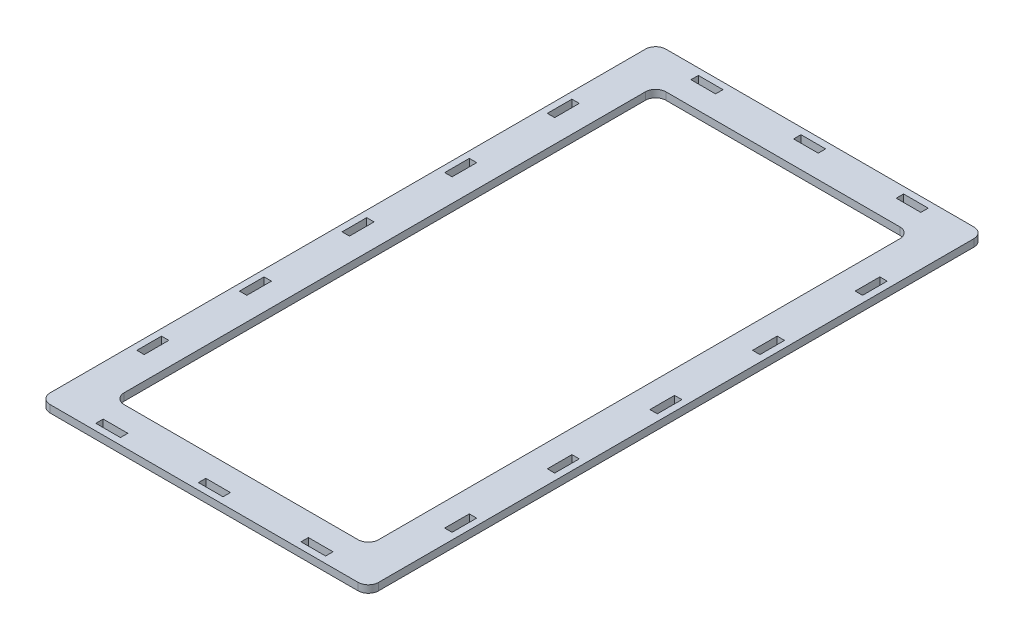
from build123d import *

# Parameters (mm, degrees)
SKETCH_1_W               = 800
SKETCH_1_H               = 1500
SKETCH_1_W_2             = 620
SKETCH_1_H_2             = 1320
EXTRUDE_1_DEPTH          = 18
SKETCH_1_5_W             = 18
SKETCH_1_5_H             = 60
CUT_EXTRUDE_1_DEPTH      = 851.190566873
PATTERN_LINEAR_1_COUNT   = 5
PATTERN_LINEAR_1_PITCH   = 250
MIRROR_1_COPY_1_SKETCH_W = 18
MIRROR_1_COPY_1_SKETCH_H = 60
MIRROR_1_COPY_1_DEPTH    = 851.190566873
MIRROR_1_COPY_2_SKETCH_W = 18
MIRROR_1_COPY_2_SKETCH_H = 60
MIRROR_1_COPY_2_DEPTH    = 851.190566873
MIRROR_1_COPY_3_SKETCH_W = 18
MIRROR_1_COPY_3_SKETCH_H = 60
MIRROR_1_COPY_3_DEPTH    = 851.190566873
MIRROR_1_COPY_4_SKETCH_W = 18
MIRROR_1_COPY_4_SKETCH_H = 60
MIRROR_1_COPY_4_DEPTH    = 851.190566873
SKETCH_1_4_W             = 60
SKETCH_1_4_H             = 18
CUT_EXTRUDE_2_DEPTH      = 851.190566873
PATTERN_LINEAR_2_COUNT   = 3
PATTERN_LINEAR_2_PITCH   = 250
MIRROR_2_COPY_1_SKETCH_W = 60
MIRROR_2_COPY_1_SKETCH_H = 18
MIRROR_2_COPY_1_DEPTH    = 851.190566873
MIRROR_2_COPY_2_SKETCH_W = 60
MIRROR_2_COPY_2_SKETCH_H = 18
MIRROR_2_COPY_2_DEPTH    = 851.190566873
FILLET_1_R               = 25
FILLET_2_R               = 25


with BuildPart() as part:
    # 草图1 → 凸台-拉伸1 (new body)
    with BuildSketch(Plane(origin=(0, 0, 0), x_dir=(1, 0, 0), z_dir=(0, 1, 0))):
        Rectangle(SKETCH_1_W, SKETCH_1_H)
        Rectangle(SKETCH_1_W_2, SKETCH_1_H_2, mode=Mode.SUBTRACT)
    extrude(amount=EXTRUDE_1_DEPTH)

    # 草图1<5> → 切除-拉伸1 (cut, through all)
    with BuildSketch(Plane(origin=(0, 0, 0), x_dir=(1, 0, 0), z_dir=(0, 1, 0))):
        with Locations((-375, -500)):
            Rectangle(SKETCH_1_5_W, SKETCH_1_5_H)
    cut_extrude_1 = extrude(amount=CUT_EXTRUDE_1_DEPTH, mode=Mode.SUBTRACT)

    # 阵列(线性)1: 切除-拉伸1 ×5
    with Locations(*[(0, 0, -i * PATTERN_LINEAR_1_PITCH) for i in range(1, PATTERN_LINEAR_1_COUNT)]):
        add(cut_extrude_1, mode=Mode.SUBTRACT)

    # 镜向1: 切除-拉伸1 across plane
    add(cut_extrude_1.mirror(Plane(origin=(0, 0, 0), x_dir=(0, 0, 1), z_dir=(1, 0, 0))), mode=Mode.SUBTRACT)

    # 镜向1 copy 1 sketch → 镜向1 copy 1 (cut, through all)
    with BuildSketch(Plane(origin=(0, 0, -250), x_dir=(-1, 0, 0), z_dir=(0, 1, 0))):
        with Locations((-375, 500)):
            Rectangle(MIRROR_1_COPY_1_SKETCH_W, MIRROR_1_COPY_1_SKETCH_H)
    extrude(amount=MIRROR_1_COPY_1_DEPTH, mode=Mode.SUBTRACT)

    # 镜向1 copy 2 sketch → 镜向1 copy 2 (cut, through all)
    with BuildSketch(Plane(origin=(0, 0, -500), x_dir=(-1, 0, 0), z_dir=(0, 1, 0))):
        with Locations((-375, 500)):
            Rectangle(MIRROR_1_COPY_2_SKETCH_W, MIRROR_1_COPY_2_SKETCH_H)
    extrude(amount=MIRROR_1_COPY_2_DEPTH, mode=Mode.SUBTRACT)

    # 镜向1 copy 3 sketch → 镜向1 copy 3 (cut, through all)
    with BuildSketch(Plane(origin=(0, 0, -750), x_dir=(-1, 0, 0), z_dir=(0, 1, 0))):
        with Locations((-375, 500)):
            Rectangle(MIRROR_1_COPY_3_SKETCH_W, MIRROR_1_COPY_3_SKETCH_H)
    extrude(amount=MIRROR_1_COPY_3_DEPTH, mode=Mode.SUBTRACT)

    # 镜向1 copy 4 sketch → 镜向1 copy 4 (cut, through all)
    with BuildSketch(Plane(origin=(0, 0, -1000), x_dir=(-1, 0, 0), z_dir=(0, 1, 0))):
        with Locations((-375, 500)):
            Rectangle(MIRROR_1_COPY_4_SKETCH_W, MIRROR_1_COPY_4_SKETCH_H)
    extrude(amount=MIRROR_1_COPY_4_DEPTH, mode=Mode.SUBTRACT)

    # 草图1<4> → 切除-拉伸2 (cut, through all)
    with BuildSketch(Plane(origin=(0, 0, 0), x_dir=(1, 0, 0), z_dir=(0, 1, 0))):
        with Locations((-250, -725)):
            Rectangle(SKETCH_1_4_W, SKETCH_1_4_H)
    cut_extrude_2 = extrude(amount=CUT_EXTRUDE_2_DEPTH, mode=Mode.SUBTRACT)

    # 阵列(线性)2: 切除-拉伸2 ×3
    with Locations(*[(i * PATTERN_LINEAR_2_PITCH, 0, 0) for i in range(1, PATTERN_LINEAR_2_COUNT)]):
        add(cut_extrude_2, mode=Mode.SUBTRACT)

    # 镜向2: 切除-拉伸2 across plane
    add(cut_extrude_2.mirror(Plane.XY), mode=Mode.SUBTRACT)

    # 镜向2 copy 1 sketch → 镜向2 copy 1 (cut, through all)
    with BuildSketch(Plane(origin=(250, 0, 0), x_dir=(1, 0, 0), z_dir=(0, 1, 0))):
        with Locations((-250, 725)):
            Rectangle(MIRROR_2_COPY_1_SKETCH_W, MIRROR_2_COPY_1_SKETCH_H)
    extrude(amount=MIRROR_2_COPY_1_DEPTH, mode=Mode.SUBTRACT)

    # 镜向2 copy 2 sketch → 镜向2 copy 2 (cut, through all)
    with BuildSketch(Plane(origin=(500, 0, 0), x_dir=(1, 0, 0), z_dir=(0, 1, 0))):
        with Locations((-250, 725)):
            Rectangle(MIRROR_2_COPY_2_SKETCH_W, MIRROR_2_COPY_2_SKETCH_H)
    extrude(amount=MIRROR_2_COPY_2_DEPTH, mode=Mode.SUBTRACT)

    # 圆角1
    fillet_1_edges = [part.edges().sort_by_distance(p)[0] for p in [
        (-400, 9, -750),
        (400, 9, -750),
        (400, 9, 750),
        (-400, 9, 750),
    ]]
    fillet(fillet_1_edges, radius=FILLET_1_R)

    # 圆角2
    fillet_2_edges = [part.edges().sort_by_distance(p)[0] for p in [
        (-310, 9, -660),
        (310, 9, -660),
        (310, 9, 660),
        (-310, 9, 660),
    ]]
    fillet(fillet_2_edges, radius=FILLET_2_R)


solid = part.part
